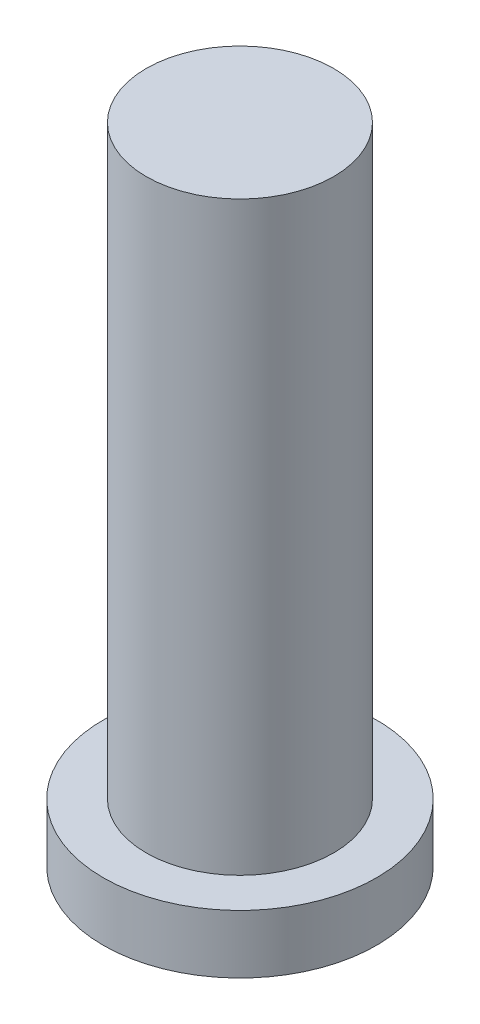
from build123d import *

# Parameters (mm, degrees)
SKETCH1_R           = 9.6
BOSS_EXTRUDE2_DEPTH = 60
SKETCH1_3_R         = 14
BOSS_EXTRUDE3_DEPTH = 6


with BuildPart() as part:
    # Sketch1 → Boss-Extrude2 (new body)
    with BuildSketch(Plane(origin=(0, 0, 0), x_dir=(1, 0, 0), z_dir=(0, 1, 0))):
        Circle(SKETCH1_R)
    extrude(amount=BOSS_EXTRUDE2_DEPTH)

    # Sketch1<3> → Boss-Extrude3 (add)
    with BuildSketch(Plane(origin=(0, 0, 0), x_dir=(1, 0, 0), z_dir=(0, 1, 0))):
        Circle(SKETCH1_3_R)
    extrude(amount=-BOSS_EXTRUDE3_DEPTH)


solid = part.part
